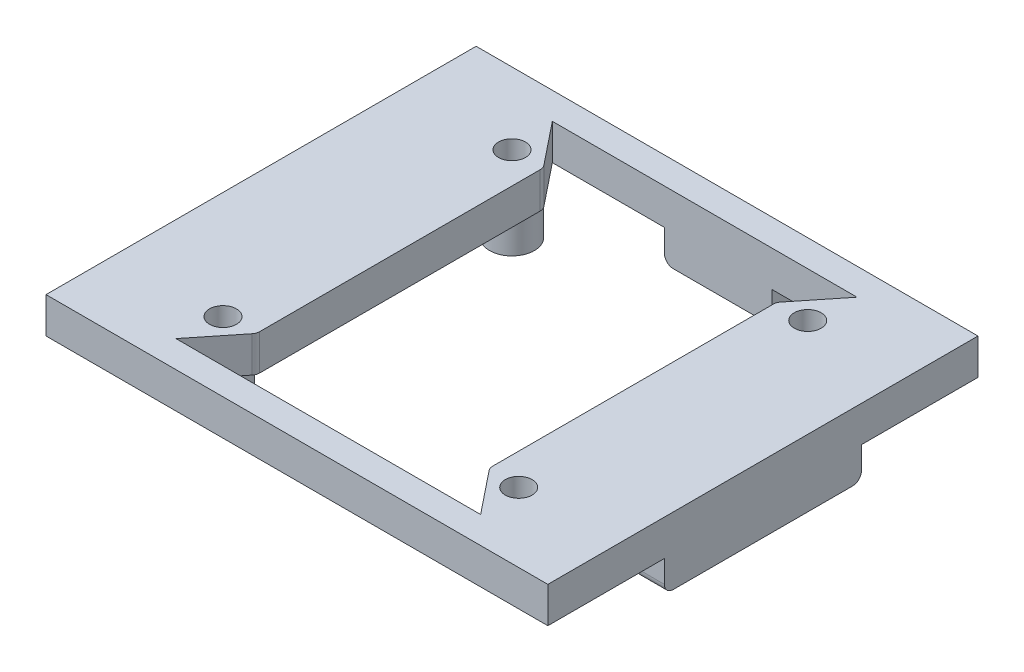
from build123d import *

# Parameters (mm, degrees)
BOSS_EXTRUDE1_DEPTH        = 6
BOSS_EXTRUDE1_DEPTH_BACK   = 2.5
SKETCH1_R                  = 2.5
SKETCH1_R_2                = 1.5
BOSS_EXTRUDE1_2_DEPTH      = 6
BOSS_EXTRUDE1_2_DEPTH_BACK = 2.5
BOSS_EXTRUDE1_3_DEPTH      = 6
BOSS_EXTRUDE1_3_DEPTH_BACK = 2.5
BOSS_EXTRUDE1_4_DEPTH      = 6
BOSS_EXTRUDE1_4_DEPTH_BACK = 2.5
SKETCH2_W                  = 50
SKETCH2_H                  = 42
BOSS_EXTRUDE3_DEPTH        = 4
CUT_EXTRUDE2_DEPTH         = 41.142251143
CUT_EXTRUDE2_DEPTH_BACK    = 41.142251143
SKETCH4_W                  = 26
SKETCH4_H                  = 32
BOSS_EXTRUDE4_DEPTH        = 3.5
BOSS_EXTRUDE4_DEPTH_BACK   = 4
SKETCH5_W                  = 3
SKETCH5_H                  = 22
BOSS_EXTRUDE5_DEPTH        = 3.5
BOSS_EXTRUDE5_DEPTH_BACK   = 4
SKETCH6_W                  = 12
SKETCH6_H                  = 3
SKETCH3_R                  = 1.5
CUT_EXTRUDE3_DEPTH         = 6
BOSS_EXTRUDE6_START        = -4
BOSS_EXTRUDE6_DEPTH        = 4
CUT_EXTRUDE6_DEPTH         = 4
FILLET1_R                  = 1
FILLET2_R                  = 1
FILLET3_R                  = 1
FILLET4_R                  = 1


# Read off the part's stored shape, not the designer's step: Boss-Extrude6
with BuildPart() as part:
    # Sketch1 → Boss-Extrude1 (new, two sides: drawn at the far end of the back side and taken through both)
    with BuildSketch(Plane(origin=(0, 0, 0), x_dir=(1, 0, 0), z_dir=(0, 1, 0)).offset(-BOSS_EXTRUDE1_DEPTH_BACK)):
        with Locations(Location((-21.137254902, 20.117647059, 0), (0, 0, 270))):
            Circle(SKETCH1_R)
        with Locations(Location((-21.137254902, 20.117647059, 0), (0, 0, 270))):
            Circle(SKETCH1_R_2, mode=Mode.SUBTRACT)
    extrude(amount=BOSS_EXTRUDE1_DEPTH + BOSS_EXTRUDE1_DEPTH_BACK)



with BuildPart() as body_2:
    # Sketch1 → Boss-Extrude1 2 (new, two sides: drawn at the far end of the back side and taken through both)
    with BuildSketch(Plane(origin=(0, 0, 0), x_dir=(1, 0, 0), z_dir=(0, 1, 0)).offset(-BOSS_EXTRUDE1_2_DEPTH_BACK)):
        with Locations(Location((11.862745098, 20.117647059, 0), (0, 0, 270))):
            Circle(SKETCH1_R)
        with Locations(Location((11.862745098, 20.117647059, 0), (0, 0, 270))):
            Circle(SKETCH1_R_2, mode=Mode.SUBTRACT)
    extrude(amount=BOSS_EXTRUDE1_2_DEPTH + BOSS_EXTRUDE1_2_DEPTH_BACK)


with BuildPart() as body_3:
    # Sketch1 → Boss-Extrude1 3 (new, two sides: drawn at the far end of the back side and taken through both)
    with BuildSketch(Plane(origin=(0, 0, 0), x_dir=(1, 0, 0), z_dir=(0, 1, 0)).offset(-BOSS_EXTRUDE1_3_DEPTH_BACK)):
        with Locations(Location((-21.137254902, -12.132352941, 0), (0, 0, 270))):
            Circle(SKETCH1_R)
        with Locations(Location((-21.137254902, -12.132352941, 0), (0, 0, 270))):
            Circle(SKETCH1_R_2, mode=Mode.SUBTRACT)
    extrude(amount=BOSS_EXTRUDE1_3_DEPTH + BOSS_EXTRUDE1_3_DEPTH_BACK)


with BuildPart() as body_4:
    # Sketch1 → Boss-Extrude1 4 (new, two sides: drawn at the far end of the back side and taken through both)
    with BuildSketch(Plane(origin=(0, 0, 0), x_dir=(1, 0, 0), z_dir=(0, 1, 0)).offset(-BOSS_EXTRUDE1_4_DEPTH_BACK)):
        with Locations(Location((11.862745098, -12.132352941, 0), (0, 0, 270))):
            Circle(SKETCH1_R)
        with Locations(Location((11.862745098, -12.132352941, 0), (0, 0, 270))):
            Circle(SKETCH1_R_2, mode=Mode.SUBTRACT)
    extrude(amount=BOSS_EXTRUDE1_4_DEPTH + BOSS_EXTRUDE1_4_DEPTH_BACK)


with BuildPart() as part_1:
    add(part.part)

    add(body_2.part)  # Boss-Extrude3 merges body 2

    add(body_3.part)  # Boss-Extrude3 merges body 3

    add(body_4.part)  # Boss-Extrude3 merges body 4
    # Sketch2 → Boss-Extrude3 (add)
    with BuildSketch(Plane(origin=(0, 6, 0), x_dir=(1, 0, 0), z_dir=(0, 1, 0))):
        with Locations((-5.137254902, 4.117647059)):
            Rectangle(SKETCH2_W, SKETCH2_H)
    extrude(amount=-BOSS_EXTRUDE3_DEPTH)

    # Sketch4 → Cut-Extrude2 (cut, two sides: drawn at the far end of the back side and taken through both)
    with BuildSketch(Plane(origin=(0, 6, 0), x_dir=(1, 0, 0), z_dir=(0, 1, 0)).offset(-CUT_EXTRUDE2_DEPTH_BACK)):
        with Locations((-4.637254902, 4.117647059)):
            Rectangle(SKETCH4_W, SKETCH4_H)
    extrude(amount=CUT_EXTRUDE2_DEPTH + CUT_EXTRUDE2_DEPTH_BACK, mode=Mode.SUBTRACT)

    # Sketch5 → Boss-Extrude4 (add, two sides: drawn at the far end of the back side and taken through both)
    with BuildSketch(Plane.XZ.offset(-2).offset(-BOSS_EXTRUDE4_DEPTH_BACK)):
        with Locations((21.362745098, -4.117647059)):
            Rectangle(SKETCH5_W, SKETCH5_H)
    extrude(amount=BOSS_EXTRUDE4_DEPTH + BOSS_EXTRUDE4_DEPTH_BACK)

    # Sketch6 → Boss-Extrude5 (add, two sides: drawn at the far end of the back side and taken through both)
    with BuildSketch(Plane.XZ.offset(-2).offset(-BOSS_EXTRUDE5_DEPTH_BACK)):
        with Locations((-3.137254902, -26.617647059)):
            Rectangle(SKETCH6_W, SKETCH6_H)
    extrude(amount=BOSS_EXTRUDE5_DEPTH + BOSS_EXTRUDE5_DEPTH_BACK)

    # Sketch3 → Cut-Extrude3 (cut)
    with BuildSketch(Plane(origin=(0, 6, 0), x_dir=(1, 0, 0), z_dir=(0, 1, 0))):
        with Locations(Location((-21.137254902, 20.117647059, 0), (0, 0, 270))):
            Circle(SKETCH3_R)
        with Locations(Location((-21.137254902, -12.132352941, 0), (0, 0, 270))):
            Circle(SKETCH3_R)
        with Locations(Location((11.862745098, -12.132352941, 0), (0, 0, 270))):
            Circle(SKETCH3_R)
        with Locations(Location((11.862745098, 20.117647059, 0), (0, 0, 270))):
            Circle(SKETCH3_R)
    extrude(amount=-CUT_EXTRUDE3_DEPTH, mode=Mode.SUBTRACT)

    # Sketch10 → Cut-Extrude6 (cut)
    with BuildSketch(Plane(origin=(0, 6, 0), x_dir=(1, 0, 0), z_dir=(0, 1, 0))):
        Polygon((8.362745098, 20.117647059), (12.362745098, 25.117647059), (-21.637254902, 25.117647059), (-17.637254902, 20.117647059), align=None)
        Polygon((-17.637254902, -11.882352941), (-21.637254902, -16.882352941), (12.362745098, -16.882352941), (8.362745098, -11.882352941), align=None)
    extrude(amount=-CUT_EXTRUDE6_DEPTH, mode=Mode.SUBTRACT)


with BuildPart() as body_2_2:
    # Boss-Extrude6 outline → Boss-Extrude6 (new body)
    with BuildSketch(Plane(origin=(0, 6, 0), x_dir=(1, 0, 0), z_dir=(0, 1, 0)).offset(BOSS_EXTRUDE6_START)):
        Polygon((-9.137254902, 25.117647059), (-9.137254902, 28.117647059), (-33.137254902, 28.117647059), (-33.137254902, -19.882352941), (22.862745098, -19.882352941), (22.862745098, -6.882352941), (19.862745098, -6.882352941), (19.862745098, -16.882352941), (-30.137254902, -16.882352941), (-30.137254902, 25.117647059), align=None)
        Polygon((22.862745098, 28.117647059), (2.862745098, 28.117647059), (2.862745098, 25.117647059), (19.862745098, 25.117647059), (19.862745098, 15.117647059), (22.862745098, 15.117647059), align=None)
    extrude(amount=BOSS_EXTRUDE6_DEPTH)


with BuildPart() as cut_extrude6_piece_1:
    # of the separate pieces the step leaves, piece 1, a body of its own (cut_extrude6_pieces)
    add(part_1.part.solids().sort_by_distance((8.362745098, 2, -20.117647059))[0])

    # Fillet2
    fillet2_edges = [cut_extrude6_piece_1.edges().sort_by_distance(p)[0] for p in [
        (8.362745098, 4, 11.882352941),
        (8.362745098, 4, -20.117647059),
    ]]
    fillet(fillet2_edges, radius=FILLET2_R)

    # Fillet4
    fillet4_edges = [cut_extrude6_piece_1.edges().sort_by_distance(p)[0] for p in [
        (21.362745098, -1.5, -15.117647059),
        (21.362745098, -1.5, 6.882352941),
    ]]
    fillet(fillet4_edges, radius=FILLET4_R)


with BuildPart() as cut_extrude6_piece_2:
    # of the separate pieces the step leaves, piece 2, a body of its own (cut_extrude6_pieces)
    add(part_1.part.solids().sort_by_distance((-21.137254902, 0, -17.617647059))[0])

    # Fillet1
    fillet1_edges = [cut_extrude6_piece_2.edges().sort_by_distance(p)[0] for p in [
        (-17.637254902, 4, 11.882352941),
        (-17.637254902, 4, -20.117647059),
    ]]
    fillet(fillet1_edges, radius=FILLET1_R)


with BuildPart() as cut_extrude6_piece_3:
    # of the separate pieces the step leaves, piece 3, a body of its own (cut_extrude6_pieces)
    add(part_1.part.solids().sort_by_distance((-9.137254902, -1.5, -25.117647059))[0])

    # Fillet3
    fillet3_edges = [cut_extrude6_piece_3.edges().sort_by_distance(p)[0] for p in [
        (-9.137254902, -1.5, -26.617647059),
        (2.862745098, -1.5, -26.617647059),
    ]]
    fillet(fillet3_edges, radius=FILLET3_R)


with BuildPart() as body_2_2_1:
    add(body_2_2.part)

    # Combine1: union Cut-Extrude6 piece 2, Cut-Extrude6 piece 3, Cut-Extrude6 piece 1
    add(cut_extrude6_piece_2.part)
    add(cut_extrude6_piece_3.part)
    add(cut_extrude6_piece_1.part)


solid = body_2_2_1.part
